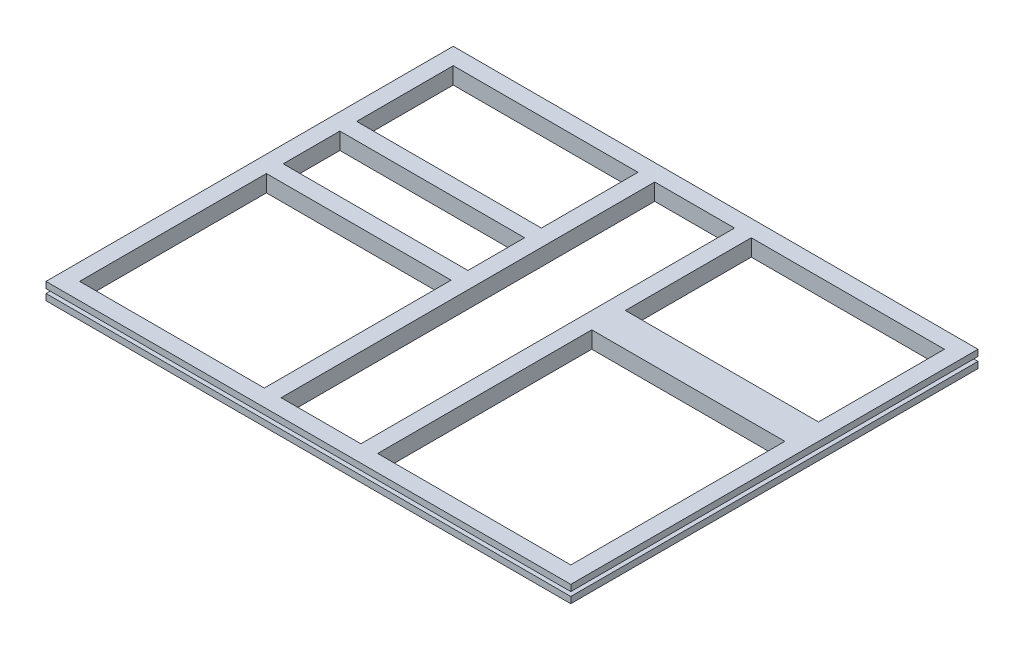
from build123d import *

# Parameters (mm, degrees)
SKETCH1_W               = 1250
SKETCH1_H               = 970
SKETCH1_W_2             = 460
SKETCH1_H_2             = 300
SKETCH1_W_3             = 440
SKETCH1_H_3             = 445
SKETCH1_H_4             = 510
SKETCH1_H_5             = 135
SKETCH1_H_6             = 230
SKETCH1_W_4             = 190
SKETCH1_H_7             = 890
BOSS_EXTRUDE1_DEPTH     = 40
CUT_EXTRUDE1_DEPTH      = 1156.004508135
CUT_EXTRUDE1_DEPTH_BACK = 1156.004508135
SKETCH2_W               = 10
SKETCH2_H               = 10
CUT_EXTRUDE2_DEPTH      = 1342.389205264
CUT_EXTRUDE2_DEPTH_BACK = 1342.389205264
SKETCH3_W               = 10
SKETCH3_H               = 10


with BuildPart() as part:
    # Sketch1 → Boss-Extrude1 (new body)
    with BuildSketch(Plane(origin=(0, 0, 0), x_dir=(1, 0, 0), z_dir=(0, 1, 0))):
        with Locations((-0.72790717, 0)):
            Rectangle(SKETCH1_W, SKETCH1_H)
        with Locations((354.27209283, 295)):
            Rectangle(SKETCH1_W_2, SKETCH1_H_2, mode=Mode.SUBTRACT)
        with Locations((-365.72790717, -222.5)):
            Rectangle(SKETCH1_W_3, SKETCH1_H_3, mode=Mode.SUBTRACT)
        with Locations((354.27209283, -190)):
            Rectangle(SKETCH1_W_2, SKETCH1_H_4, mode=Mode.SUBTRACT)
        with Locations((-365.72790717, 107.5)):
            Rectangle(SKETCH1_W_3, SKETCH1_H_5, mode=Mode.SUBTRACT)
        with Locations((-365.72790717, 330)):
            Rectangle(SKETCH1_W_3, SKETCH1_H_6, mode=Mode.SUBTRACT)
        with Locations((-10.72790717, 0)):
            Rectangle(SKETCH1_W_4, SKETCH1_H_7, mode=Mode.SUBTRACT)
    extrude(amount=BOSS_EXTRUDE1_DEPTH)

    # Sketch2 → Cut-Extrude1 (cut, two sides: drawn at the far end of the back side and taken through both)
    with BuildSketch(Plane.XY.offset(485).offset(-CUT_EXTRUDE1_DEPTH_BACK)):
        with Locations((-620.72790717, 20)):
            Rectangle(SKETCH2_W, SKETCH2_H)
        with Locations((619.27209283, 20)):
            Rectangle(SKETCH2_W, SKETCH2_H)
    extrude(amount=CUT_EXTRUDE1_DEPTH + CUT_EXTRUDE1_DEPTH_BACK, mode=Mode.SUBTRACT)

    # Sketch3 → Cut-Extrude2 (cut, two sides: drawn at the far end of the back side and taken through both)
    with BuildSketch(Plane.ZY.offset(625.72790717).offset(-CUT_EXTRUDE2_DEPTH_BACK)):
        with Locations((480, 20)):
            Rectangle(SKETCH3_W, SKETCH3_H)
        with Locations((-480, 20)):
            Rectangle(SKETCH3_W, SKETCH3_H)
    extrude(amount=CUT_EXTRUDE2_DEPTH + CUT_EXTRUDE2_DEPTH_BACK, mode=Mode.SUBTRACT)


solid = part.part
